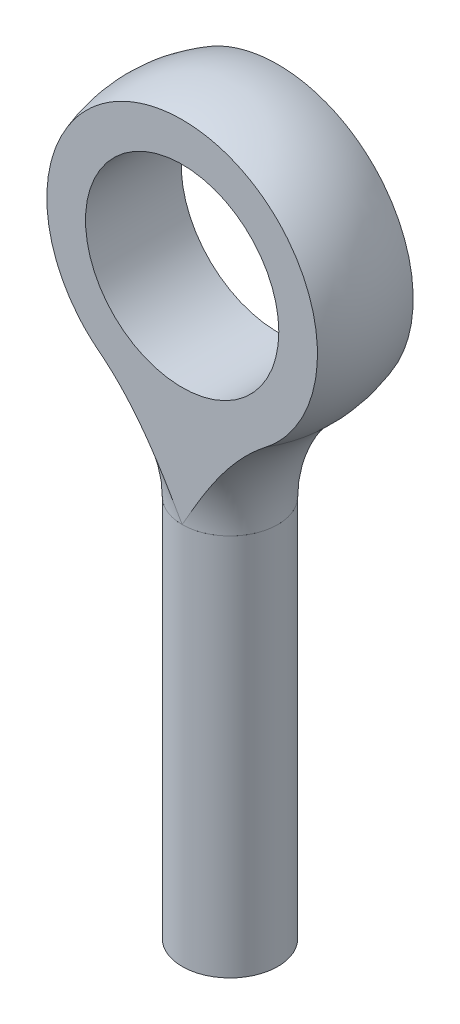
from build123d import *

# Parameters (mm, degrees)
SKETCH14_W               = 3.175
SKETCH14_H               = 25.4
CUT_EXTRUDE10_DEPTH      = 29.750847814
CUT_EXTRUDE10_DEPTH_BACK = 29.750847814
CUT_EXTRUDE9_DEPTH       = 28.312382734
CUT_EXTRUDE9_DEPTH_BACK  = 28.312382734
SKETCH17_R               = 6.4135


with BuildPart() as part:
    # Sketch14 → Revolve4 (revolve)
    with BuildSketch(Plane.XY):
        with Locations((1.5875, -12.7)):
            Rectangle(SKETCH14_W, SKETCH14_H)
    revolve(axis=Axis((0, 0, 0), (0, -1, 0)))


with BuildPart() as body_2:
    # Sketch21 → Revolve5 (revolve)
    with BuildSketch(Plane.XY):
        with BuildLine():
            Line((0, 23.8125), (0, 0))
            Line((0, 0), (3.175, 0))
            ThreePointArc((3.175, 0), (4.01304802, 3.949061991), (6.382731959, 7.217396907))
            ThreePointArc((6.382731959, 7.217396907), (8.890116899, 17.70677573), (0, 23.8125))
        make_face()
    revolve(axis=Axis((0, 0, 0), (0, -1, 0)))

    # Sketch24 → Cut-Extrude10 (cut, two sides: drawn at the far end of the back side and taken through both)
    with BuildSketch(Plane(origin=(0, 0, 0), x_dir=(0, 0, -1), z_dir=(1, 0, 0)).offset(-CUT_EXTRUDE10_DEPTH_BACK)):
        Polygon((3.175, 14.2875), (3.175, 23.8125), (9.525, 23.8125), (9.525, 0), (3.175, 0), (3.175, 0.635), align=None)
        Polygon((-3.175, 0), (-9.525, 0), (-9.525, 23.8125), (-3.175, 23.8125), (-3.175, 14.2875), (-3.175, 0.635), align=None)
    extrude(amount=CUT_EXTRUDE10_DEPTH + CUT_EXTRUDE10_DEPTH_BACK, mode=Mode.SUBTRACT)

    # Sketch17 → Cut-Extrude9 (cut, two sides: drawn at the far end of the back side and taken through both)
    with BuildSketch(Plane.XY.offset(-CUT_EXTRUDE9_DEPTH_BACK)):
        with Locations((0, 14.2875)):
            Circle(SKETCH17_R)
    extrude(amount=CUT_EXTRUDE9_DEPTH + CUT_EXTRUDE9_DEPTH_BACK, mode=Mode.SUBTRACT)


solid = Compound([part.part, body_2.part])
